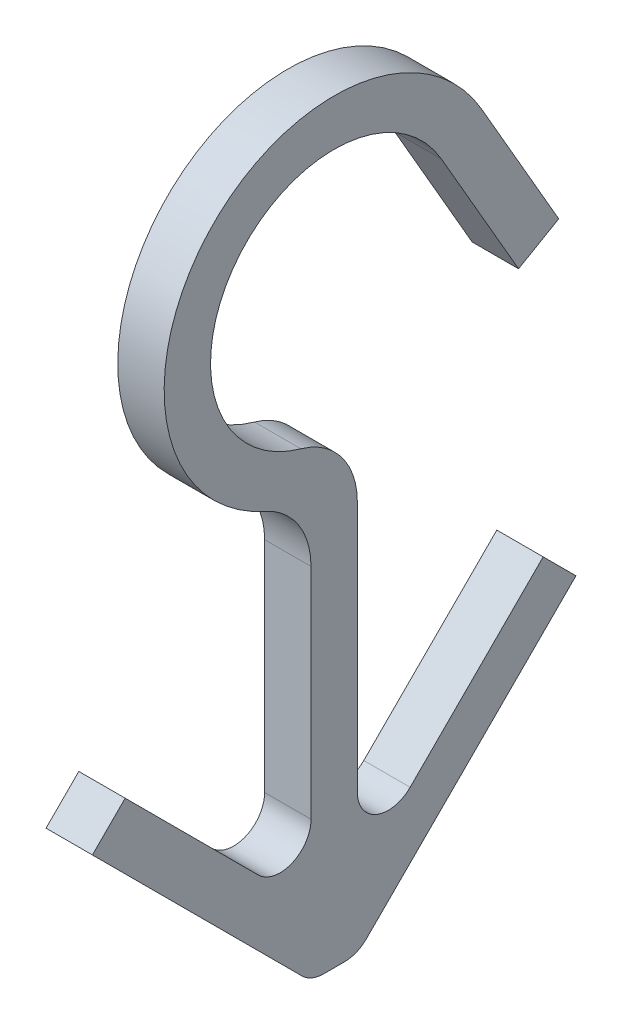
from build123d import *

# Parameters (mm, degrees)
SKETCH1_R           = 22
SKETCH1_R_2         = 16
BOSS_EXTRUDE1_DEPTH = 6
BOSS_EXTRUDE2_DEPTH = 6
CUT_EXTRUDE1_DEPTH  = 37.933063475
SKETCH4_W           = 6
SKETCH4_H           = 30
BOSS_EXTRUDE3_DEPTH = 6
CUT_EXTRUDE2_DEPTH  = 55.497937543
FILLET1_R           = 10
FILLET2_R           = 10
SKETCH6_W           = 6
SKETCH6_H           = 30
BOSS_EXTRUDE4_DEPTH = 6
FILLET3_R           = 4


with BuildPart() as part:
    # Sketch1 → Boss-Extrude1 (new body)
    with BuildSketch(Plane(origin=(0, 0, 0), x_dir=(0, 0, -1), z_dir=(1, 0, 0))):
        Circle(SKETCH1_R)
        Circle(SKETCH1_R_2, mode=Mode.SUBTRACT)
    extrude(amount=BOSS_EXTRUDE1_DEPTH)

    # Sketch2 → Boss-Extrude2 (add)
    with BuildSketch(Plane(origin=(6, 0, 0), x_dir=(0, 0, -1), z_dir=(1, 0, 0))):
        Polygon((19.052558883, 11), (29.052558883, -6.320508076), (23.856406461, -9.320508076), (13.856406461, 8), align=None)
    extrude(amount=-BOSS_EXTRUDE2_DEPTH)

    # Sketch3 → Cut-Extrude1 (cut, through all)
    with BuildSketch(Plane(origin=(6, 0, 0), x_dir=(0, 0, -1), z_dir=(1, 0, 0))):
        with BuildLine():
            ThreePointArc((16, 0), (12.693653445, -9.740182864), (4.141104722, -15.454813221))
            Line((4.141104722, -15.454813221), (5.694018992, -21.250368178))
            ThreePointArc((5.694018992, -21.250368178), (15.779826764, -15.329614062), (21.406240896, -5.076696831))
            Line((21.406240896, -5.076696831), (13.856406461, 8))
            ThreePointArc((13.856406461, 8), (15.454813221, 4.141104722), (16, 0))
        make_face()
    extrude(amount=-CUT_EXTRUDE1_DEPTH, mode=Mode.SUBTRACT)

    # Sketch4 → Boss-Extrude3 (add)
    with BuildSketch(Plane(origin=(6, 0, 0), x_dir=(0, 0, -1), z_dir=(1, 0, 0))):
        with Locations((0, -30.716233646)):
            Rectangle(SKETCH4_W, SKETCH4_H)
    extrude(amount=-BOSS_EXTRUDE3_DEPTH)

    # Sketch5 → Cut-Extrude2 (cut, through all)
    with BuildSketch(Plane(origin=(6, 0, 0), x_dir=(0, 0, -1), z_dir=(1, 0, 0))):
        with BuildLine():
            Line((3, -21.794494718), (3, -15.716233646))
            Line((3, -15.716233646), (4.141104722, -15.454813221))
            Line((4.141104722, -15.454813221), (5.694018992, -21.250368178))
            ThreePointArc((5.694018992, -21.250368178), (4.374209957, -21.657103353), (3, -21.794494718))
        make_face()
    extrude(amount=-CUT_EXTRUDE2_DEPTH, mode=Mode.SUBTRACT)

    # Fillet1
    # the kernel refuses this fillet: 10 mm, written as the material it adds along each edge
    with BuildSketch(Plane(origin=(6, -21.794494718, 3), x_dir=(0, -1, 0), z_dir=(-1, 0, 0))) as fillet1_piece_1:
        with BuildLine():
            CenterArc((7.445888317, 10), FILLET1_R, 203.969482318, 66.030517682)
            ThreePointArc((-1.691731382, 5.9375), (-0.636552127, 3.028388286), (0, 0))
            Line((0, 0), (7.445888317, 0))
        make_face()
    extrude(amount=6)
    # the kernel refuses this fillet: 10 mm, written as the material it takes off along each edge
    with BuildSketch(Plane(origin=(28.912878475, -15.716233646, -3), x_dir=(0, -1, 0), z_dir=(-1, 0, 0))) as fillet1_2_piece_1:
        with BuildLine():
            CenterArc((9.16515139, 10), FILLET1_R, 203.578178478, 66.421821522)
            Line((0, 6), (0, 0))
            Line((0, 0), (9.16515139, 0))
        make_face()
    extrude(amount=51.82575695, mode=Mode.SUBTRACT)

    # Fillet2
    fillet2_edges = [part.edges().sort_by_distance(p)[0] for p in [
        (3, -15.716233646, 3),
    ]]
    fillet(fillet2_edges, radius=FILLET2_R)

    # Sketch6 → Boss-Extrude4 (add)
    with BuildSketch(Plane.ZY):
        Polygon((27.04163056, -43.189321711), (3, -67.230952271), (3, -75.716233646), (31.284271247, -47.431962398), align=None)
        with Locations((0, -60.716233646)):
            Rectangle(SKETCH6_W, SKETCH6_H)
    boss_extrude4 = extrude(amount=-BOSS_EXTRUDE4_DEPTH)

    # Mirror1: Boss-Extrude4 across plane
    add(boss_extrude4.mirror(Plane.XY))

    # Fillet3
    fillet3_edges = [part.edges().sort_by_distance(p)[0] for p in [
        (3, -75.716233646, 3),
        (3, -75.716233646, -3),
        (3, -67.230952271, 3),
        (3, -67.230952271, -3),
    ]]
    fillet(fillet3_edges, radius=FILLET3_R)


solid = part.part
